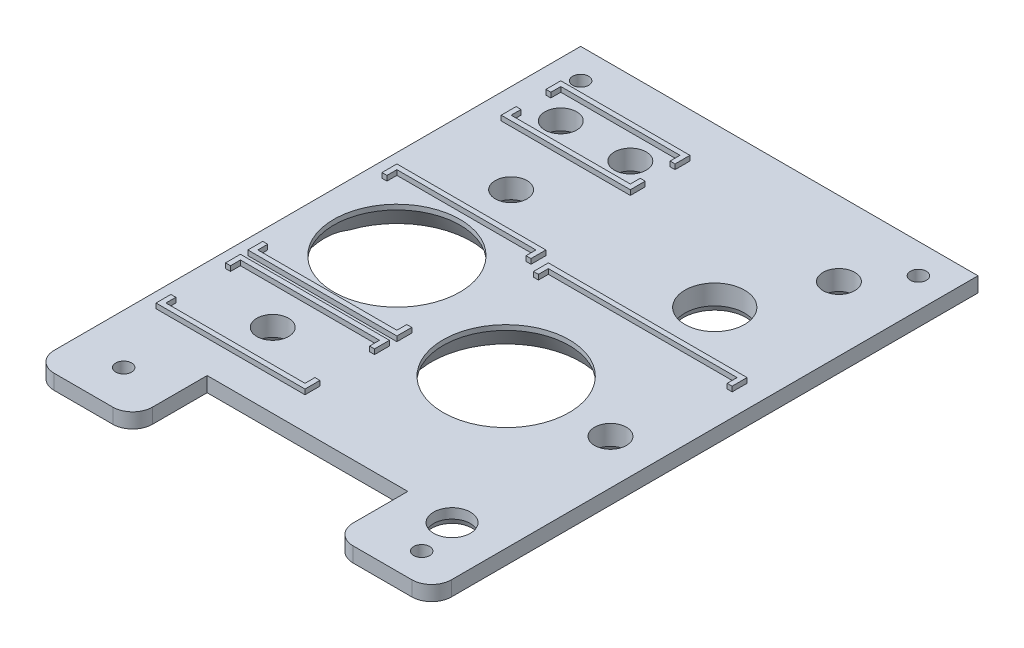
from build123d import *
from OCP.BRepFilletAPI import BRepFilletAPI_MakeChamfer

# Parameters (mm, degrees)
SKETCH1_W           = 80
SKETCH1_H           = 110
BOSS_EXTRUDE1_DEPTH = 3
SKETCH2_W           = 40.4
SKETCH2_H           = 3
CUT_EXTRUDE1_DEPTH  = 15
FILLET1_R           = 4
SKETCH7_W           = 73.6
SKETCH7_H           = 86.6
BOSS_EXTRUDE2_DEPTH = 2
SKETCH3_R           = 12.7
CUT_EXTRUDE2_DEPTH  = 69.190908485
SKETCH4_R           = 6
SKETCH4_R_2         = 3.2
SKETCH4_R_3         = 3.7
SKETCH4_R_4         = 1.6
CUT_EXTRUDE3_DEPTH  = 69.190908485
CHAMFER2_SIZE       = 1.5
CHAMFER2_SIZE2      = 0.545955351
CHAMFER3_SIZE       = 2.309401077
CHAMFER3_SIZE_2     = 4
BOSS_EXTRUDE3_DEPTH = 1
CHAMFER4_SIZE       = 1
CHAMFER4_SIZE2      = 0.363970234
CUT_EXTRUDE4_DEPTH  = 4
CUT_EXTRUDE5_START  = -4
CUT_EXTRUDE5_DEPTH  = 4


with BuildPart() as part:
    # Sketch1 → Boss-Extrude1 (new body)
    with BuildSketch(Plane(origin=(0, 0, 0), x_dir=(1, 0, 0), z_dir=(0, 1, 0))):
        Rectangle(SKETCH1_W, SKETCH1_H)
    extrude(amount=BOSS_EXTRUDE1_DEPTH)

    # Sketch2 → Cut-Extrude1 (cut)
    with BuildSketch(Plane.XY.offset(55)):
        with Locations((0, 1.5)):
            Rectangle(SKETCH2_W, SKETCH2_H)
    extrude(amount=-CUT_EXTRUDE1_DEPTH, mode=Mode.SUBTRACT)

    # Fillet1
    fillet1_edges = [part.edges().sort_by_distance(p)[0] for p in [
        (-20.2, 1.5, 55),
        (20.2, 1.5, 55),
        (40, 1.5, 55),
        (-40, 1.5, 55),
    ]]
    fillet(fillet1_edges, radius=FILLET1_R)

    # Sketch7 → Boss-Extrude2 (add)
    with BuildSketch(Plane.XZ):
        with Locations((0, -8.5)):
            Rectangle(SKETCH7_W, SKETCH7_H)
    extrude(amount=BOSS_EXTRUDE2_DEPTH)

    # Sketch3 → Cut-Extrude2 (cut, through all)
    with BuildSketch(Plane(origin=(0, 3, 0), x_dir=(1, 0, 0), z_dir=(0, 1, 0))):
        with Locations(Location((-22, 0, 0), (0, 0, 270))):
            Circle(SKETCH3_R)
        with Locations(Location((10, -10, 0), (0, 0, 270))):
            Circle(SKETCH3_R)
    extrude(amount=-CUT_EXTRUDE2_DEPTH, mode=Mode.SUBTRACT)

    # Sketch4 → Cut-Extrude3 (cut, through all)
    with BuildSketch(Plane(origin=(0, 3, 0), x_dir=(1, 0, 0), z_dir=(0, 1, 0))):
        with Locations(Location((19, 23, 0), (0, 0, 270))):
            Circle(SKETCH4_R)
        with Locations(Location((-22, 23, 0), (0, 0, 270))):
            Circle(SKETCH4_R_2)
        with Locations(Location((31, -10, 0), (0, 0, 270))):
            Circle(SKETCH4_R_2)
        with Locations(Location((30.1, -41, 0), (0, 0, 270))):
            Circle(SKETCH4_R_3)
        with Locations(Location((-29, 40, 0), (0, 0, 270))):
            Circle(SKETCH4_R_2)
        with Locations(Location((-15, 40, 0), (0, 0, 270))):
            Circle(SKETCH4_R_2)
        with Locations(Location((27, 40, 0), (0, 0, 270))):
            Circle(SKETCH4_R_2)
        with Locations(Location((-22, -25, 0), (0, 0, 270))):
            Circle(SKETCH4_R_2)
        with Locations(Location((-30, -47, 0), (0, 0, 270))):
            Circle(SKETCH4_R_4)
        with Locations(Location((-34, 49, 0), (0, 0, 270))):
            Circle(SKETCH4_R_4)
        with Locations(Location((34, 49, 0), (0, 0, 270))):
            Circle(SKETCH4_R_4)
        with Locations(Location((32, -49, 0), (0, 0, 270))):
            Circle(SKETCH4_R_4)
    extrude(amount=-CUT_EXTRUDE3_DEPTH, mode=Mode.SUBTRACT)

    # Chamfer2: one chamfer whose edges measure the first distance from different faces: ONE call of the kernel's chamfer builder (chamfer() names one face for all edges)
    chamfer2_edges_1 = [part.edges().sort_by_distance(p)[0] for p in [
        (-36.8, -2, -8.5),
    ]]
    chamfer2_side_1 = [part.faces().sort_by_distance(p)[0] for p in [
        (-36.8, -1, -8.5),
    ]]
    chamfer2_edges_2 = [part.edges().sort_by_distance(p)[0] for p in [
        (0, -2, -51.8),
    ]]
    chamfer2_side_2 = [part.faces().sort_by_distance(p)[0] for p in [
        (0, -1, -51.8),
    ]]
    chamfer2_edges_3 = [part.edges().sort_by_distance(p)[0] for p in [
        (36.8, -2, -8.5),
    ]]
    chamfer2_side_3 = [part.faces().sort_by_distance(p)[0] for p in [
        (36.8, -1, -8.5),
    ]]
    chamfer2_edges_4 = [part.edges().sort_by_distance(p)[0] for p in [
        (0, -2, 34.8),
    ]]
    chamfer2_side_4 = [part.faces().sort_by_distance(p)[0] for p in [
        (0, -1, 34.8),
    ]]
    chamfer2 = BRepFilletAPI_MakeChamfer(part.part.solid().wrapped)
    for e in chamfer2_edges_1:
        chamfer2.Add(CHAMFER2_SIZE, CHAMFER2_SIZE2, e.wrapped, chamfer2_side_1[0].wrapped)  # the first distance lies on this face
    for e in chamfer2_edges_2:
        chamfer2.Add(CHAMFER2_SIZE, CHAMFER2_SIZE2, e.wrapped, chamfer2_side_2[0].wrapped)  # the first distance lies on this face
    for e in chamfer2_edges_3:
        chamfer2.Add(CHAMFER2_SIZE, CHAMFER2_SIZE2, e.wrapped, chamfer2_side_3[0].wrapped)  # the first distance lies on this face
    for e in chamfer2_edges_4:
        chamfer2.Add(CHAMFER2_SIZE, CHAMFER2_SIZE2, e.wrapped, chamfer2_side_4[0].wrapped)  # the first distance lies on this face
    add(Compound.cast(chamfer2.Shape()), mode=Mode.REPLACE)

    # Chamfer3
    # the kernel refuses this chamfer: 4, 2.309401077 mm, written as the material it takes off along each edge
    with BuildSketch(Plane(origin=(-22, -2, 0), x_dir=(0, 0, 1), z_dir=(-1, 0, 0))) as chamfer3_piece_1:
        Polygon((12.7 + CHAMFER3_SIZE, 0), (12.7, CHAMFER3_SIZE_2), (12.7, 0), align=None)
    revolve(axis=Axis((-22, -2, 0), (0, 1, 0)), mode=Mode.SUBTRACT)
    with BuildSketch(Plane(origin=(10, -2, 10), x_dir=(0, 0, 1), z_dir=(-1, 0, 0))) as chamfer3_piece_2:
        Polygon((12.7 + CHAMFER3_SIZE, 0), (12.7, CHAMFER3_SIZE_2), (12.7, 0), align=None)
    revolve(axis=Axis((10, -2, 10), (0, 1, 0)), mode=Mode.SUBTRACT)

    # Sketch8 → Boss-Extrude3 (add)
    with BuildSketch(Plane(origin=(0, 3, 0), x_dir=(1, 0, 0), z_dir=(0, 1, 0))):
        Polygon((-35, 43), (-35, 46), (-9, 46), (-9, 43), (-10, 43), (-10, 45), (-34, 45), (-34, 43), align=None)
        Polygon((-9, 37), (-9, 34), (-35, 34), (-35, 37), (-34, 37), (-34, 35), (-10, 35), (-10, 37), align=None)
        Polygon((-37, 12), (-37, 15), (-7, 15), (-7, 12), (-8, 12), (-8, 14), (-36, 14), (-36, 12), align=None)
        Polygon((-4.5, 10), (-4.5, 13), (35.5, 13), (35.5, 10), (34.5, 10), (34.5, 12), (-3.5, 12), (-3.5, 10), align=None)
        Polygon((-7, -12), (-7, -15), (-37, -15), (-37, -12), (-36, -12), (-36, -14), (-8, -14), (-8, -12), align=None)
        Polygon((-37, -19.5), (-37, -16.5), (-7, -16.5), (-7, -19.5), (-8, -19.5), (-8, -17.5), (-36, -17.5), (-36, -19.5), align=None)
        Polygon((-7, -30.5), (-7, -33.5), (-37, -33.5), (-37, -30.5), (-36, -30.5), (-36, -32.5), (-8, -32.5), (-8, -30.5), align=None)
    extrude(amount=BOSS_EXTRUDE3_DEPTH)

    # Chamfer4: one chamfer whose edges measure the first distance from different faces: ONE call of the kernel's chamfer builder (chamfer() names one face for all edges)
    chamfer4_edges_1 = [part.edges().sort_by_distance(p)[0] for p in [
        (-22, -2, 21.8),
    ]]
    chamfer4_side_1 = [part.faces().sort_by_distance(p)[0] for p in [
        (-22, 0.5, 21.8),
    ]]
    chamfer4_edges_2 = [part.edges().sort_by_distance(p)[0] for p in [
        (-22, -2, -26.2),
    ]]
    chamfer4_side_2 = [part.faces().sort_by_distance(p)[0] for p in [
        (-22, 0.5, -26.2),
    ]]
    chamfer4_edges_3 = [part.edges().sort_by_distance(p)[0] for p in [
        (31, -2, 6.8),
    ]]
    chamfer4_side_3 = [part.faces().sort_by_distance(p)[0] for p in [
        (31, 0.5, 6.8),
    ]]
    chamfer4_edges_4 = [part.edges().sort_by_distance(p)[0] for p in [
        (30.1, 0, 37.3),
    ]]
    chamfer4_side_4 = [part.faces().sort_by_distance(p)[0] for p in [
        (30.1, 1.5, 37.3),
    ]]
    chamfer4_edges_5 = [part.edges().sort_by_distance(p)[0] for p in [
        (-29, -2, -43.2),
    ]]
    chamfer4_side_5 = [part.faces().sort_by_distance(p)[0] for p in [
        (-29, 0.5, -43.2),
    ]]
    chamfer4_edges_6 = [part.edges().sort_by_distance(p)[0] for p in [
        (-15, -2, -43.2),
    ]]
    chamfer4_side_6 = [part.faces().sort_by_distance(p)[0] for p in [
        (-15, 0.5, -43.2),
    ]]
    chamfer4_edges_7 = [part.edges().sort_by_distance(p)[0] for p in [
        (19, -2, -29),
    ]]
    chamfer4_side_7 = [part.faces().sort_by_distance(p)[0] for p in [
        (19, 0.5, -29),
    ]]
    chamfer4_edges_8 = [part.edges().sort_by_distance(p)[0] for p in [
        (27, -2, -43.2),
    ]]
    chamfer4_side_8 = [part.faces().sort_by_distance(p)[0] for p in [
        (27, 0.5, -43.2),
    ]]
    chamfer4 = BRepFilletAPI_MakeChamfer(part.part.solid().wrapped)
    for e in chamfer4_edges_1:
        chamfer4.Add(CHAMFER4_SIZE, CHAMFER4_SIZE2, e.wrapped, chamfer4_side_1[0].wrapped)  # the first distance lies on this face
    for e in chamfer4_edges_2:
        chamfer4.Add(CHAMFER4_SIZE, CHAMFER4_SIZE2, e.wrapped, chamfer4_side_2[0].wrapped)  # the first distance lies on this face
    for e in chamfer4_edges_3:
        chamfer4.Add(CHAMFER4_SIZE, CHAMFER4_SIZE2, e.wrapped, chamfer4_side_3[0].wrapped)  # the first distance lies on this face
    for e in chamfer4_edges_4:
        chamfer4.Add(CHAMFER4_SIZE, CHAMFER4_SIZE2, e.wrapped, chamfer4_side_4[0].wrapped)  # the first distance lies on this face
    for e in chamfer4_edges_5:
        chamfer4.Add(CHAMFER4_SIZE, CHAMFER4_SIZE2, e.wrapped, chamfer4_side_5[0].wrapped)  # the first distance lies on this face
    for e in chamfer4_edges_6:
        chamfer4.Add(CHAMFER4_SIZE, CHAMFER4_SIZE2, e.wrapped, chamfer4_side_6[0].wrapped)  # the first distance lies on this face
    for e in chamfer4_edges_7:
        chamfer4.Add(CHAMFER4_SIZE, CHAMFER4_SIZE2, e.wrapped, chamfer4_side_7[0].wrapped)  # the first distance lies on this face
    for e in chamfer4_edges_8:
        chamfer4.Add(CHAMFER4_SIZE, CHAMFER4_SIZE2, e.wrapped, chamfer4_side_8[0].wrapped)  # the first distance lies on this face
    add(Compound.cast(chamfer4.Shape()), mode=Mode.REPLACE)

    # Sketch9 → Cut-Extrude4 (cut)
    with BuildSketch(Plane(origin=(36.8, 0, 0), x_dir=(0, 0, -1), z_dir=(1, 0, 0))):
        with BuildLine():
            Line((40.46, -2), (32.46, -2))
            ThreePointArc((32.46, -2), (36.46, -0.5), (40.46, -2))
        make_face()
    extrude(amount=-CUT_EXTRUDE4_DEPTH, mode=Mode.SUBTRACT)

    # Sketch10 → Cut-Extrude5 (cut)
    with BuildSketch(Plane.ZY.offset(36.8).offset(CUT_EXTRUDE5_START)):
        with BuildLine():
            Line((-40.46, -2), (-32.46, -2))
            ThreePointArc((-32.46, -2), (-36.46, -0.5), (-40.46, -2))
        make_face()
    extrude(amount=CUT_EXTRUDE5_DEPTH, mode=Mode.SUBTRACT)


solid = part.part
